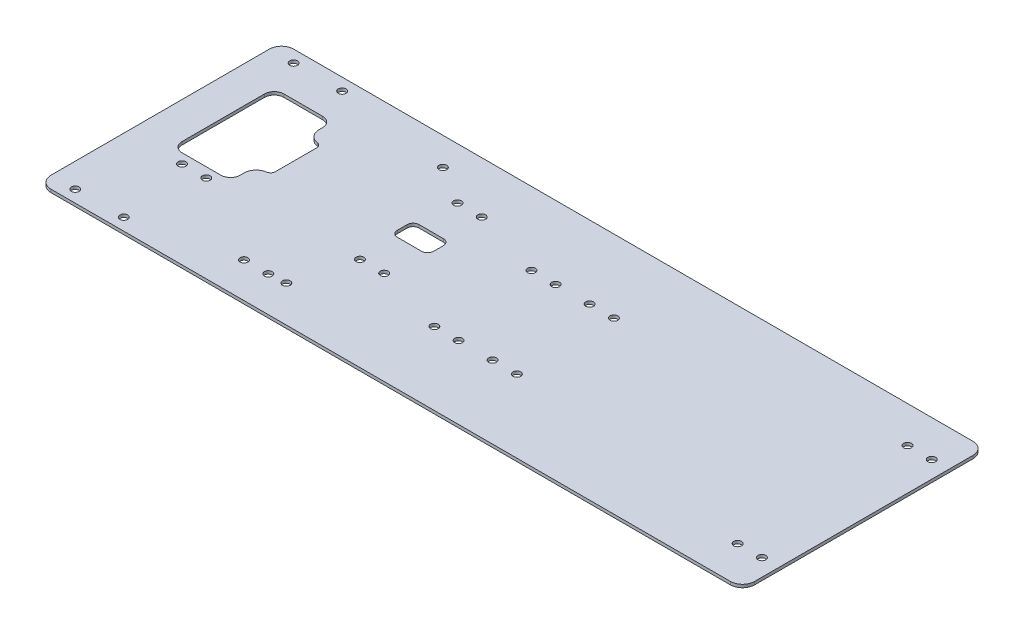
from build123d import *

# Parameters (mm, degrees)
SKETCH1_W               = 368.3
SKETCH1_H               = 127
SKETCH1_R               = 2.032
BOSS_EXTRUDE1_DEPTH     = 1.5875
FILLET1_R               = 5.08
FILLET3_R               = 6.35
FILLET4_R               = 2.54
FILLET5_R               = 6.35
CUT_EXTRUDE6_DEPTH      = 195.797311855
CUT_EXTRUDE6_DEPTH_BACK = 195.797311855
SKETCH4_R               = 2.032
CUT_EXTRUDE7_DEPTH      = 195.797311855
CUT_EXTRUDE7_DEPTH_BACK = 195.797311855
SKETCH6_R               = 2.032
CUT_EXTRUDE8_DEPTH      = 195.797311855


with BuildPart() as part:
    # Sketch1 → Boss-Extrude1 (new body)
    with BuildSketch(Plane(origin=(0, 0, 0), x_dir=(1, 0, 0), z_dir=(0, 1, 0))):
        Rectangle(SKETCH1_W, SKETCH1_H)
        with Locations((-171.45, -57.15)):
            Circle(SKETCH1_R, mode=Mode.SUBTRACT)
        with Locations((-146.05, -57.15)):
            Circle(SKETCH1_R, mode=Mode.SUBTRACT)
        with Locations((-95.25, -45.0215)):
            Circle(SKETCH1_R, mode=Mode.SUBTRACT)
        with Locations((-82.55, -45.0215)):
            Circle(SKETCH1_R, mode=Mode.SUBTRACT)
        with Locations((-154.94, -17.78)):
            Circle(SKETCH1_R, mode=Mode.SUBTRACT)
        with Locations((-142.24, -17.78)):
            Circle(SKETCH1_R, mode=Mode.SUBTRACT)
        Polygon((-134.62, -12.7), (-165.1, -12.7), (-165.1, 40.64), (-134.62, 40.64), (-134.62, 27.305), (-127, 27.305), (-127, 0.635), (-134.62, 0.635), align=None, mode=Mode.SUBTRACT)
        with Locations((-171.45, 57.15)):
            Circle(SKETCH1_R, mode=Mode.SUBTRACT)
        with Locations((-146.05, 57.15)):
            Circle(SKETCH1_R, mode=Mode.SUBTRACT)
    extrude(amount=BOSS_EXTRUDE1_DEPTH)

    # Fillet1
    fillet1_edges = [part.edges().sort_by_distance(p)[0] for p in [
        (-134.62, 0.79375, 12.7),
        (-165.1, 0.79375, 12.7),
        (-165.1, 0.79375, -40.64),
        (-134.62, 0.79375, -40.64),
    ]]
    fillet(fillet1_edges, radius=FILLET1_R)

    # Fillet3
    fillet3_edges = [part.edges().sort_by_distance(p)[0] for p in [
        (184.15, 0.79375, 63.5),
        (184.15, 0.79375, -63.5),
        (-184.15, 0.79375, 63.5),
        (-184.15, 0.79375, -63.5),
    ]]
    fillet(fillet3_edges, radius=FILLET3_R)

    # Fillet4
    fillet4_edges = [part.edges().sort_by_distance(p)[0] for p in [
        (-127, 0.79375, -0.635),
        (-127, 0.79375, -27.305),
    ]]
    fillet(fillet4_edges, radius=FILLET4_R)

    # Fillet5
    fillet5_edges = [part.edges().sort_by_distance(p)[0] for p in [
        (-134.62, 0.79375, -0.635),
        (-134.62, 0.79375, -27.305),
    ]]
    fillet(fillet5_edges, radius=FILLET5_R)

    # Sketch4 → Cut-Extrude6 (cut, two sides: drawn at the far end of the back side and taken through both)
    with BuildSketch(Plane(origin=(0, 1.5875, 0), x_dir=(1, 0, 0), z_dir=(0, 1, 0)).offset(-CUT_EXTRUDE6_DEPTH_BACK)):
        with Locations((-65.136533, 36.598997136)):
            Circle(SKETCH4_R)
        with Locations((-52.436533, 36.598997136)):
            Circle(SKETCH4_R)
        with Locations((-65.136533, -14.463384864)):
            Circle(SKETCH4_R)
        with Locations((-52.436533, -14.463384864)):
            Circle(SKETCH4_R)
    extrude(amount=CUT_EXTRUDE6_DEPTH + CUT_EXTRUDE6_DEPTH_BACK, mode=Mode.SUBTRACT)

    # Sketch5 → Cut-Extrude7 (cut, two sides: drawn at the far end of the back side and taken through both)
    with BuildSketch(Plane(origin=(0, 1.5875, 0), x_dir=(1, 0, 0), z_dir=(0, 1, 0)).offset(-CUT_EXTRUDE7_DEPTH_BACK)):
        with BuildLine():
            ThreePointArc((-65.375, 16.780348954), (-67.62006403, 15.850412984), (-68.55, 13.605348954))
            Line((-68.55, 13.605348954), (-68.55, 8.525348954))
            ThreePointArc((-68.55, 8.525348954), (-67.62006403, 6.280284924), (-65.375, 5.350348954))
            Line((-65.375, 5.350348954), (-52.675, 5.332779336))
            ThreePointArc((-52.675, 5.332779336), (-50.42993597, 6.262715306), (-49.5, 8.507779336))
            Line((-49.5, 8.507779336), (-49.5, 13.587779336))
            ThreePointArc((-49.5, 13.587779336), (-50.42993597, 15.832843366), (-52.675, 16.762779336))
            Line((-52.675, 16.762779336), (-65.375, 16.780348954))
        make_face()
    extrude(amount=CUT_EXTRUDE7_DEPTH + CUT_EXTRUDE7_DEPTH_BACK, mode=Mode.SUBTRACT)

    # Sketch6 → Cut-Extrude8 (cut, through all)
    with BuildSketch(Plane(origin=(0, 1.5875, 0), x_dir=(1, 0, 0), z_dir=(0, 1, 0))):
        with Locations((-85.09, 48.895)):
            Circle(SKETCH6_R)
        with Locations((-73.66, -44.45)):
            Circle(SKETCH6_R)
        with Locations((-2.54, -25.4)):
            Circle(SKETCH6_R)
        with Locations((-15.24, -25.4)):
            Circle(SKETCH6_R)
        with Locations((-15.24, 25.4)):
            Circle(SKETCH6_R)
        with Locations((-2.54, 25.4)):
            Circle(SKETCH6_R)
        with Locations((15.24, 25.4)):
            Circle(SKETCH6_R)
        with Locations((27.94, 25.4)):
            Circle(SKETCH6_R)
        with Locations((15.24, -25.4)):
            Circle(SKETCH6_R)
        with Locations((27.94, -25.4)):
            Circle(SKETCH6_R)
        with Locations((175.26, 44.45)):
            Circle(SKETCH6_R)
        with Locations((162.56, 44.45)):
            Circle(SKETCH6_R)
        with Locations((175.26, -44.45)):
            Circle(SKETCH6_R)
        with Locations((162.56, -44.45)):
            Circle(SKETCH6_R)
    extrude(amount=-CUT_EXTRUDE8_DEPTH, mode=Mode.SUBTRACT)


solid = part.part
